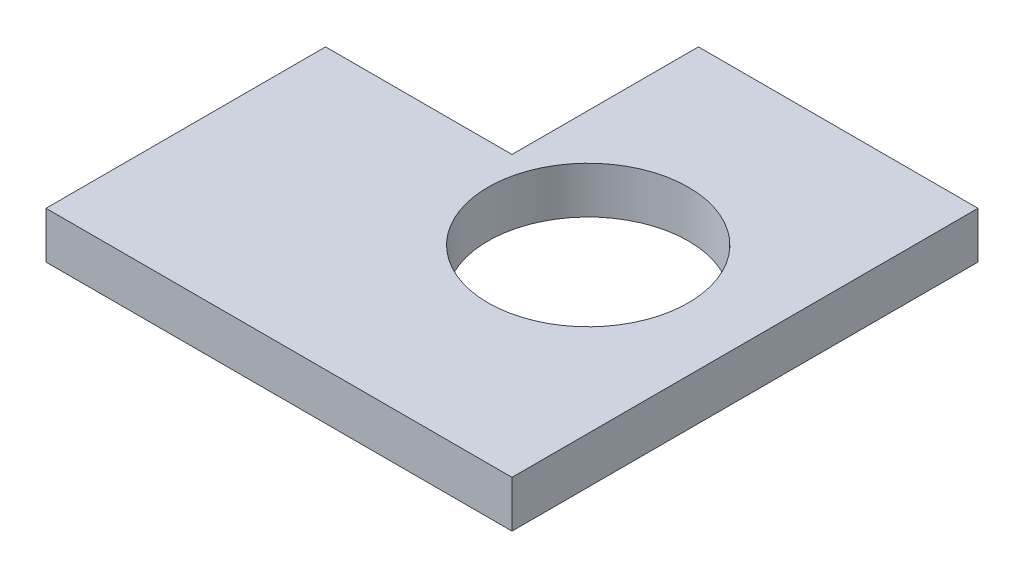
from build123d import *

# Parameters (mm, degrees)
SKETCH_1_R      = 21.5
EXTRUDE_1_DEPTH = 10


with BuildPart() as part:
    # Эскиз1 → Бобышка-Вытянуть1 (new body)
    with BuildSketch(Plane(origin=(0, 0, 0), x_dir=(1, 0, 0), z_dir=(0, 1, 0))):
        Polygon((0, 0), (100, 0), (100, 100), (40, 100), (40, 60), (0, 60), align=None)
        with Locations((65, 51.351902178)):
            Circle(SKETCH_1_R, mode=Mode.SUBTRACT)
    extrude(amount=EXTRUDE_1_DEPTH)


solid = part.part
